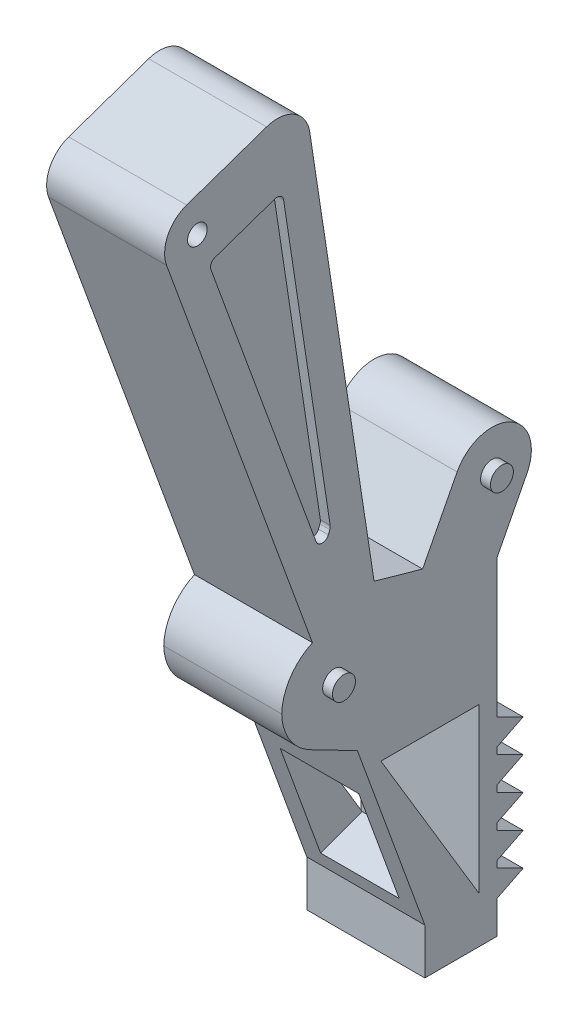
from build123d import *

# Parameters (mm, degrees)
BOSS_EXTRUDE1_DEPTH = 9
CUT_EXTRUDE1_DEPTH  = 25
BOSS_EXTRUDE2_DEPTH = 18
LPATTERN1_COUNT     = 5
LPATTERN1_PITCH     = 5
FILLET2_R           = 5
FILLET3_R           = 8
SKETCH4_R           = 1.5
CUT_EXTRUDE2_DEPTH  = 18
SKETCH6_W           = 6
SKETCH6_H           = 18.02956864
CUT_EXTRUDE3_DEPTH  = 8
SKETCH7_R           = 1.75
BOSS_EXTRUDE3_DEPTH = 1.5
CUT_EXTRUDE8_DEPTH  = 1.5


with BuildPart() as part:
    # Sketch1 → Boss-Extrude1 (new, symmetric)
    with BuildSketch(Plane(origin=(0, 0, 0), x_dir=(0, 0, -1), z_dir=(1, 0, 0))):
        with BuildLine():
            Line((90.984883898, -2.862650195), (95.574427473, 6.021948264))
            ThreePointArc((95.574427473, 6.021948264), (92.997394543, 14.106433484), (84.912909322, 11.529400554))
            Line((84.912909322, 11.529400554), (79.647841616, 1.337098931))
            Line((79.647841616, 1.337098931), (72.241979914, 3.428014696))
            Line((72.241979914, 3.428014696), (62.847901181, 0))
            Line((62.847901181, 0), (58.150861814, -1.714007348))
            Line((58.150861814, -1.714007348), (58.150861814, -11.714007348))
            Line((58.150861814, -11.714007348), (69.700839811, -17.680413995))
            Line((69.700839811, -17.680413995), (79.984883898, -45.862650195))
            Line((79.984883898, -45.862650195), (79.984883898, -52.862650195))
            Line((79.984883898, -52.862650195), (90.984883898, -52.862650195))
            Line((90.984883898, -52.862650195), (90.984883898, -2.862650195))
        make_face()
        Polygon((72.241979914, 3.428014696), (62.847901181, 0), (38.851798311, 65.758551133), (61.529389306, 73.615195879), align=None)
    extrude(amount=BOSS_EXTRUDE1_DEPTH, both=True)

    # Sketch2 → Cut-Extrude1 (cut)
    with BuildSketch(Plane(origin=(9, 0, 0), x_dir=(0, 0, -1), z_dir=(1, 0, 0))):
        Polygon((88.284883898, -45.862650195), (88.284883898, -20.862650195), (73.284883898, -20.862650195), align=None)
    extrude(amount=-CUT_EXTRUDE1_DEPTH, mode=Mode.SUBTRACT)

    # Sketch3 → Boss-Extrude2 (add)
    with BuildSketch(Plane(origin=(9, 0, 0), x_dir=(0, 0, -1), z_dir=(1, 0, 0))):
        Polygon((94.984883898, -45.862650195), (90.984883898, -45.862650195), (90.984883898, -47.862650195), align=None)
        Polygon((90.984883898, -43.862650195), (90.984883898, -45.862650195), (94.984883898, -45.862650195), align=None)
    boss_extrude2 = extrude(amount=-BOSS_EXTRUDE2_DEPTH)

    # LPattern1: Boss-Extrude2 ×5
    with Locations(*[(0, i * LPATTERN1_PITCH, 0) for i in range(1, LPATTERN1_COUNT)]):
        add(boss_extrude2)

    # Fillet2
    fillet2_edges = [part.edges().sort_by_distance(p)[0] for p in [
        (0, 65.758551133, -38.851798311),
        (0, 73.615195879, -61.529389306),
    ]]
    fillet(fillet2_edges, radius=FILLET2_R)

    # Fillet3
    # the kernel refuses this fillet: 8 mm, written as the material it takes off along each edge
    with BuildSketch(Plane(origin=(-21.179405631, -11.714007348, -58.150861814), x_dir=(0, 1, 0), z_dir=(1, 0, 0))) as fillet3_piece_1:
        with BuildLine():
            CenterArc((FILLET3_R * 0.608970281556, -FILLET3_R), FILLET3_R, 90, 62.680345336)
            Line((-FILLET3_R * 0.279489564314, -FILLET3_R * 0.541045642491), (-FILLET3_R * 0.297258761231, -FILLET3_R * 0.531866555341))
            Line((-FILLET3_R * 0.297258761231, -FILLET3_R * 0.531866555341), (-FILLET3_R * 0.0121794056311, FILLET3_R * 0.02))
            Line((-FILLET3_R * 0.0121794056311, FILLET3_R * 0.02), (FILLET3_R * 0.608970281556, FILLET3_R * 0.02))
            Line((FILLET3_R * 0.608970281556, FILLET3_R * 0.02), (FILLET3_R * 0.608970281556, 0))
        make_face()
    extrude(amount=42.358811262, mode=Mode.SUBTRACT)
    with BuildSketch(Plane(origin=(-22.930780243, -1.714007348, -58.150861814), x_dir=(0, 0.34280146956229973, -0.9394078733254942), z_dir=(1, 0, 0))) as fillet3_piece_2:
        with BuildLine():
            CenterArc((5.605066211, -7.977085613), FILLET3_R, 94.33760972, 65.614743341)
            Line((-1.910196776, -5.234673857), (-2.060502036, -5.179825622))
            Line((-2.060502036, -5.179825622), (-0.15030526, 0.054848235))
            Line((-0.15030526, 0.054848235), (0, 0.16))
            ThreePointArc((0, 0.16), (2.5, 0.16), (4.987898676, 0.159541712))
            Line((4.987898676, 0.159541712), (5, 0))
        make_face()
    extrude(amount=45.861560486, mode=Mode.SUBTRACT)

    # Sketch4 → Cut-Extrude2 (cut)
    with BuildSketch(Plane(origin=(9, 0, 0), x_dir=(0, 0, -1), z_dir=(1, 0, 0))):
        with Locations((45.291168566, 62.697901722)):
            Circle(SKETCH4_R)
    extrude(amount=-CUT_EXTRUDE2_DEPTH, mode=Mode.SUBTRACT)

    # Sketch6 → Cut-Extrude3 (cut)
    with BuildSketch(Plane(origin=(0, 20.368113495, -55.816464867), x_dir=(1, 0, 0), z_dir=(0, -0.342801469564146, 0.9394078733248205))):
        with Locations((-3, -58.877510112)):
            Rectangle(SKETCH6_W, SKETCH6_H)
        with Locations((3, -58.877510112)):
            Rectangle(SKETCH6_W, SKETCH6_H)
    extrude(amount=-CUT_EXTRUDE3_DEPTH, mode=Mode.SUBTRACT)

    # Sketch7 → Boss-Extrude3 (add)
    with BuildSketch(Plane(origin=(9, 0, 0), x_dir=(0, 0, -1), z_dir=(1, 0, 0))):
        with Locations((90.243668397, 8.775674409)):
            Circle(SKETCH7_R)
        with Locations((66.150861814, -6.842245095)):
            Circle(SKETCH7_R)
    boss_extrude3 = extrude(amount=BOSS_EXTRUDE3_DEPTH)

    # Sketch9 → Cut-Extrude8 (cut)
    with BuildSketch(Plane(origin=(9, 0, 0), x_dir=(0, 0, -1), z_dir=(1, 0, 0))):
        with BuildLine():
            Line((58.440866419, 60.71212793), (65.549781573, 14.135652246))
            ThreePointArc((65.549781573, 14.135652246), (65.554544576, 13.869334092), (65.488833832, 13.611205938))
            Line((65.488833832, 13.611205938), (65.263485326, 13.051639762))
            ThreePointArc((65.263485326, 13.051639762), (64.319406176, 12.425340234), (63.396473347, 13.082403042))
            Line((63.396473347, 13.082403042), (47.353872306, 57.045300124))
            ThreePointArc((47.353872306, 57.045300124), (47.390108621, 57.817381382), (47.965919982, 58.333001219))
            Line((47.965919982, 58.333001219), (57.124954374, 61.506145996))
            ThreePointArc((57.124954374, 61.506145996), (57.968947683, 61.417453255), (58.440866419, 60.71212793))
        make_face()
    cut_extrude8 = extrude(amount=-CUT_EXTRUDE8_DEPTH, mode=Mode.SUBTRACT)

    # Mirror1: Boss-Extrude3, Cut-Extrude8 across plane
    add(boss_extrude3.mirror(Plane(origin=(0, 0, 0), x_dir=(0, 0, 1), z_dir=(1, 0, 0))))
    add(cut_extrude8.mirror(Plane(origin=(0, 0, 0), x_dir=(0, 0, 1), z_dir=(1, 0, 0))), mode=Mode.SUBTRACT)


solid = part.part
